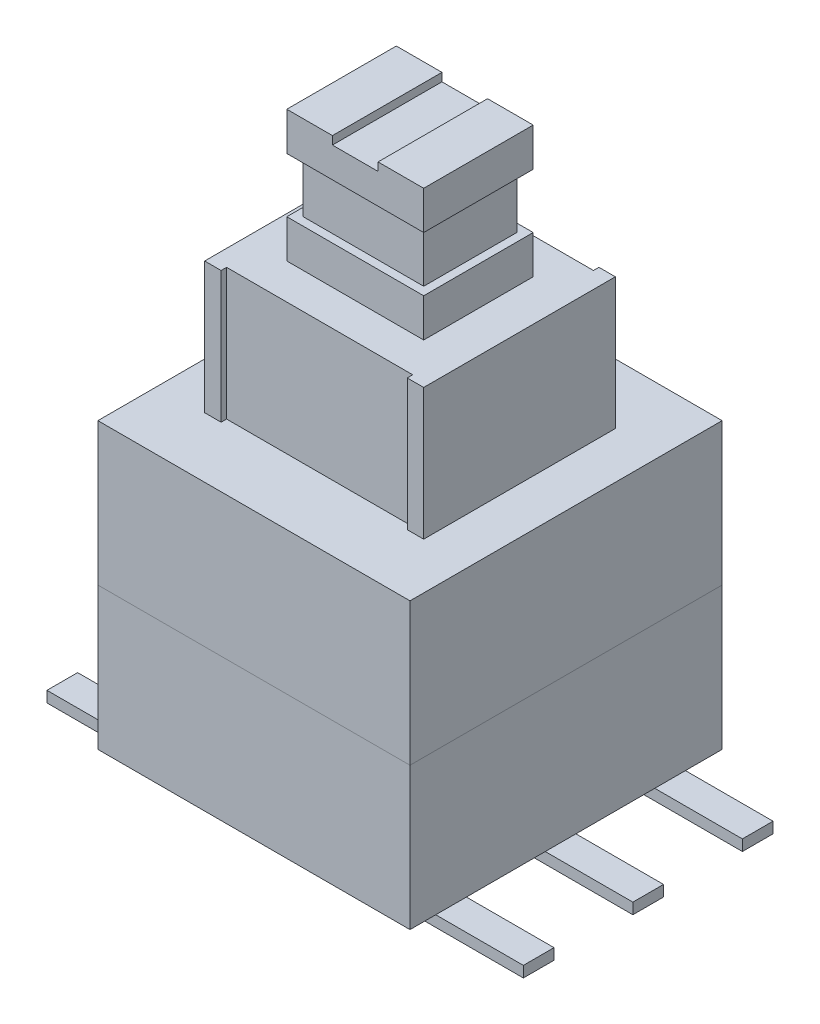
from build123d import *

# Parameters (mm, degrees)
SKETCH_1_W                     = 5.7
SKETCH_1_H                     = 5.7
EXTRUDE_1_DEPTH                = 5.2
SPLIT_BODIES_1_SURFACE_1_BACK  = 10.593
SPLIT_BODIES_1_SURFACE_1_DEPTH = 21.186
SPLIT_BODIES_1_SURFACE_2_BACK  = 10.593
SPLIT_BODIES_1_SURFACE_2_DEPTH = 21.186
SKETCH_3_W                     = 4
SKETCH_3_H                     = 3.5
EXTRUDE_2_DEPTH                = 2.4
EXTRUDE_START                  = 2.4
SKETCH_3_3_W                   = 2.5
SKETCH_3_3_H                   = 2
EXTRUDE_3_DEPTH                = 2.4
SKETCH_4_W                     = 0.833333334
SKETCH_4_H                     = 0.3
CUT_EXTRUDE_1_DEPTH            = 12.088056638
SWEEP_START                    = 8.3
SWEEP_1_OUTLINE_W              = 2.5
SWEEP_1_OUTLINE_H              = 2
SWEEP_1_OUTLINE_W_2            = 2.2
SWEEP_1_OUTLINE_H_2            = 1.7
SWEEP_1_DEPTH                  = 1
SKETCH_10_W                    = 3.4
SKETCH_10_H                    = 0.2
CUT_EXTRUDE_2_DEPTH            = 2.4
SKETCH_14_W                    = 0.2
SKETCH_14_H                    = 0.56
EXTRUDE_5_DEPTH                = 0.3
SKETCH_15_W                    = 0.56
SKETCH_15_H                    = 0.2
EXTRUDE_6_DEPTH                = 2
SKETCH_16_W                    = 0.56
SKETCH_16_H                    = 0.2
EXTRUDE_7_DEPTH                = 2
FILLET_1_R                     = 0.2


with BuildPart() as part:
    # Эскиз1 → Бобышка-Вытянуть1 (new body)
    with BuildSketch(Plane(origin=(0, 0, 0), x_dir=(1, 0, 0), z_dir=(0, 1, 0))):
        Rectangle(SKETCH_1_W, SKETCH_1_H)
    extrude(amount=EXTRUDE_1_DEPTH)


with BuildPart() as body_2:
    # Split Bodies 1: the piece behind the surface
    add(part.part)
    # Split Bodies 1 surface: a surface, the sketch's curves swept straight by 21.186 mm
    with BuildLine(Plane.XY.offset(2.85).offset(-SPLIT_BODIES_1_SURFACE_1_BACK), mode=Mode.PRIVATE) as split_bodies_1_surface_1_path:
        Line((-2.85, 2.6), (2.85, 2.6))
    split_bodies_1_surface_1 = Shell.extrude(split_bodies_1_surface_1_path.wire(), (0 * SPLIT_BODIES_1_SURFACE_1_DEPTH, 0 * SPLIT_BODIES_1_SURFACE_1_DEPTH, 1 * SPLIT_BODIES_1_SURFACE_1_DEPTH))
    split(bisect_by=split_bodies_1_surface_1, keep=Keep.BOTTOM)

    # Эскиз14 → Бобышка-Вытянуть5 (add)
    with BuildSketch(Plane.XZ):
        with Locations((-2.25, 0)):
            Rectangle(SKETCH_14_W, SKETCH_14_H)
        with Locations((-2.25, 2)):
            Rectangle(SKETCH_14_W, SKETCH_14_H)
        with Locations((-2.25, -2)):
            Rectangle(SKETCH_14_W, SKETCH_14_H)
        with Locations((2.25, -2)):
            Rectangle(SKETCH_14_W, SKETCH_14_H)
        with Locations((2.25, 2)):
            Rectangle(SKETCH_14_W, SKETCH_14_H)
        with Locations((2.25, 0)):
            Rectangle(SKETCH_14_W, SKETCH_14_H)
    extrude(amount=EXTRUDE_5_DEPTH)

    # Эскиз15 → Бобышка-Вытянуть6 (add)
    with BuildSketch(Plane(origin=(2.35, 0, 0), x_dir=(0, 0, -1), z_dir=(1, 0, 0))):
        with Locations((-2, -0.2)):
            Rectangle(SKETCH_15_W, SKETCH_15_H)
        with Locations((0, -0.2)):
            Rectangle(SKETCH_15_W, SKETCH_15_H)
        with Locations((2, -0.2)):
            Rectangle(SKETCH_15_W, SKETCH_15_H)
    extrude(amount=EXTRUDE_6_DEPTH)

    # Эскиз16 → Бобышка-Вытянуть7 (add)
    with BuildSketch(Plane.ZY.offset(2.35)):
        with Locations((2, -0.2)):
            Rectangle(SKETCH_16_W, SKETCH_16_H)
        with Locations((0, -0.2)):
            Rectangle(SKETCH_16_W, SKETCH_16_H)
        with Locations((-2, -0.2)):
            Rectangle(SKETCH_16_W, SKETCH_16_H)
    extrude(amount=EXTRUDE_7_DEPTH)

    # Скругление1
    # the kernel refuses this fillet: 0.2 mm, written as the material it adds along each edge
    with BuildSketch(Plane(origin=(2.35, -0.1, -2.28), x_dir=(1, 0, 0), z_dir=(0, 0, 1)), Plane(origin=(2.35, -0.1, -0.28), x_dir=(1, 0, 0), z_dir=(0, 0, 1))) as fillet_1_piece_1:
        with BuildLine():
            CenterArc((0.173205081, 0.2), FILLET_1_R, 210, 60)
            Line((0, 0.1), (0, 0))
            Line((0, 0), (0.173205081, 0))
        make_face()
    extrude(amount=0.56)
    with BuildSketch(Plane(origin=(2.35, -0.1, 1.72), x_dir=(0, 1, 0), z_dir=(0, 0, 1))) as fillet_1_piece_2:
        with BuildLine():
            CenterArc((0.2, -0.173205081), FILLET_1_R, 120, 60)
            Line((0, -0.173205081), (0, 0))
            Line((0, 0), (0.1, 0))
        make_face()
    extrude(amount=0.56)
    with BuildSketch(Plane(origin=(-2.35, -0.1, -2.28), x_dir=(-1, 0, 0), z_dir=(0, 0, 1)), Plane(origin=(-2.35, -0.1, -0.28), x_dir=(-1, 0, 0), z_dir=(0, 0, 1))) as fillet_1_piece_3:
        with BuildLine():
            CenterArc((0.173205081, -0.2), FILLET_1_R, 90, 60)
            Line((0, -0.1), (0, 0))
            Line((0, 0), (0.173205081, 0))
        make_face()
    extrude(amount=0.56)
    with BuildSketch(Plane(origin=(-2.35, -0.1, 1.72), x_dir=(0, 1, 0), z_dir=(0, 0, 1))) as fillet_1_piece_4:
        with BuildLine():
            CenterArc((0.2, 0.173205081), FILLET_1_R, 180, 60)
            Line((0, 0.173205081), (0, 0))
            Line((0, 0), (0.1, 0))
        make_face()
    extrude(amount=0.56)
    # the kernel refuses this fillet: 0.2 mm, written as the material it takes off along each edge
    with BuildSketch(Plane(origin=(2.15, -0.3, 1.22), x_dir=(0, 1, 0), z_dir=(0, 0, 1)), Plane(origin=(2.15, -0.3, -0.78), x_dir=(0, 1, 0), z_dir=(0, 0, 1)), Plane(origin=(2.15, -0.3, -2.78), x_dir=(0, 1, 0), z_dir=(0, 0, 1)), Plane(origin=(-2.15, -0.3, 2.78), x_dir=(0, 1, 0), z_dir=(0, 0, -1))) as fillet_1_2_piece_1:
        with BuildLine():
            CenterArc((FILLET_1_R, -FILLET_1_R), FILLET_1_R, 90, 90)
            Line((0, -FILLET_1_R), (0, 0))
            Line((0, 0), (FILLET_1_R, 0))
        make_face()
    extrude(amount=1.56, mode=Mode.SUBTRACT)
    with BuildSketch(Plane(origin=(-2.15, -0.3, -2.78), x_dir=(0, 1, 0), z_dir=(0, 0, 1)), Plane(origin=(-2.15, -0.3, -0.78), x_dir=(0, 1, 0), z_dir=(0, 0, 1))) as fillet_1_2_piece_2:
        with BuildLine():
            CenterArc((FILLET_1_R, FILLET_1_R), FILLET_1_R, 180, 90)
            Line((0, FILLET_1_R), (0, 0))
            Line((0, 0), (FILLET_1_R, 0))
        make_face()
    extrude(amount=1.56, mode=Mode.SUBTRACT)


with BuildPart() as part_1:
    add(part.part)

    # Split Bodies 1: split by a surface, the side it looks to stays
    # Split Bodies 1 surface: a surface, the sketch's curves swept straight by 21.186 mm
    with BuildLine(Plane.XY.offset(2.85).offset(-SPLIT_BODIES_1_SURFACE_2_BACK), mode=Mode.PRIVATE) as split_bodies_1_surface_2_path:
        Line((-2.85, 2.6), (2.85, 2.6))
    split_bodies_1_surface_2 = Shell.extrude(split_bodies_1_surface_2_path.wire(), (0 * SPLIT_BODIES_1_SURFACE_2_DEPTH, 0 * SPLIT_BODIES_1_SURFACE_2_DEPTH, 1 * SPLIT_BODIES_1_SURFACE_2_DEPTH))
    split(bisect_by=split_bodies_1_surface_2, keep=Keep.TOP)


with BuildPart() as body_3:
    # Эскиз3 → Бобышка-Вытянуть2 (new body)
    with BuildSketch(Plane(origin=(0, 5.2, 0), x_dir=(1, 0, 0), z_dir=(0, 1, 0))):
        Rectangle(SKETCH_3_W, SKETCH_3_H)
    extrude(amount=EXTRUDE_2_DEPTH)

    # Эскиз3<3> → Бобышка-Вытянуть3 (add)
    with BuildSketch(Plane(origin=(0, 5.2, 0), x_dir=(1, 0, 0), z_dir=(0, 1, 0)).offset(EXTRUDE_START)):
        Rectangle(SKETCH_3_3_W, SKETCH_3_3_H)
    extrude(amount=EXTRUDE_3_DEPTH)

    # Эскиз4 → Вырез-Вытянуть1 (cut, through all)
    with BuildSketch(Plane.XY.offset(1)):
        with Locations((0, 10)):
            Rectangle(SKETCH_4_W, SKETCH_4_H)
    extrude(amount=-CUT_EXTRUDE_1_DEPTH, mode=Mode.SUBTRACT)

    # Вырез-По траектории1: read off the stored shape, not the designer's step
    # Вырез-По траектории1 outline → Вырез-По траектории1 (cut)
    with BuildSketch(Plane(origin=(0, 0, 0), x_dir=(1, 0, 0), z_dir=(0, 1, 0)).offset(SWEEP_START)):
        Rectangle(SWEEP_1_OUTLINE_W, SWEEP_1_OUTLINE_H)
        Rectangle(SWEEP_1_OUTLINE_W_2, SWEEP_1_OUTLINE_H_2, mode=Mode.SUBTRACT)
    extrude(amount=SWEEP_1_DEPTH, mode=Mode.SUBTRACT)

    # Эскиз10 → Вырез-Вытянуть2 (cut)
    with BuildSketch(Plane(origin=(0, 7.6, 0), x_dir=(1, 0, 0), z_dir=(0, 1, 0))):
        with Locations((0, -1.75)):
            Rectangle(SKETCH_10_W, SKETCH_10_H)
        with Locations((0, 1.75)):
            Rectangle(SKETCH_10_W, SKETCH_10_H)
    extrude(amount=-CUT_EXTRUDE_2_DEPTH, mode=Mode.SUBTRACT)


solid = Compound([body_2.part, part_1.part, body_3.part])
